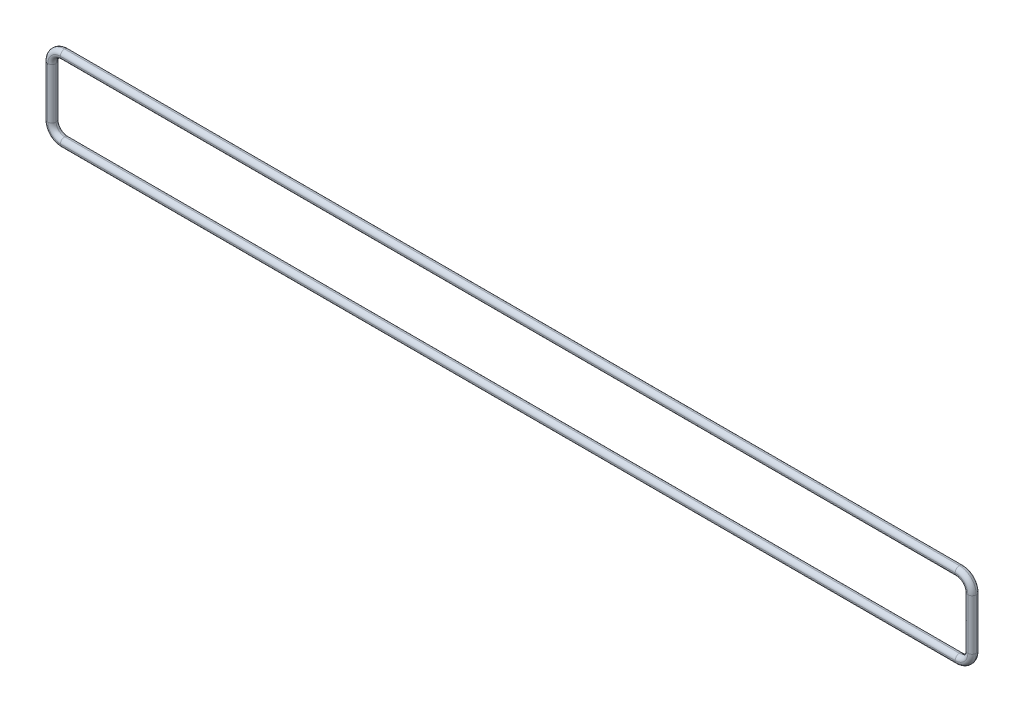
from build123d import *

# Parameters (mm, degrees)
BOSS_EXTRUDE1_DEPTH = 6.35
FILLET3_R           = 3.175


with BuildPart() as part:
    # Sketch2 → Boss-Extrude1 (new body)
    with BuildSketch(Plane.XY):
        with BuildLine():
            Line((0, 0), (0, 38.1))
            ThreePointArc((0, 38.1), (3.719743879, 47.080256121), (12.7, 50.8))
            Line((12.7, 50.8), (685.8, 50.8))
            ThreePointArc((685.8, 50.8), (694.780256121, 47.080256121), (698.5, 38.1))
            Line((698.5, 38.1), (698.5, 0))
            ThreePointArc((698.5, 0), (694.780256121, -8.980256121), (685.8, -12.7))
            Line((685.8, -12.7), (12.7, -12.7))
            ThreePointArc((12.7, -12.7), (3.719743879, -8.980256121), (0, 0))
        make_face()
        with BuildLine():
            Line((6.35, 38.1), (6.35, 0))
            ThreePointArc((6.35, 0), (8.209871939, -4.490128061), (12.7, -6.35))
            Line((12.7, -6.35), (685.8, -6.35))
            ThreePointArc((685.8, -6.35), (690.290128061, -4.490128061), (692.15, 0))
            Line((692.15, 0), (692.15, 38.1))
            ThreePointArc((692.15, 38.1), (690.290128061, 42.590128061), (685.8, 44.45))
            Line((685.8, 44.45), (12.7, 44.45))
            ThreePointArc((12.7, 44.45), (8.209871939, 42.590128061), (6.35, 38.1))
        make_face(mode=Mode.SUBTRACT)
    extrude(amount=BOSS_EXTRUDE1_DEPTH)

    # Fillet3
    fillet3_edges = [part.edges().sort_by_distance(p)[0] for p in [
        (0, 19.05, 6.35),
        (3.719743879, 47.080256121, 6.35),
        (349.25, 50.8, 6.35),
        (694.780256121, 47.080256121, 6.35),
        (698.5, 19.05, 6.35),
        (694.780256121, -8.980256121, 6.35),
        (349.25, -12.7, 6.35),
        (3.719743879, -8.980256121, 6.35),
        (0, 19.05, 0),
        (3.719743879, 47.080256121, 0),
        (349.25, 50.8, 0),
        (694.780256121, 47.080256121, 0),
        (698.5, 19.05, 0),
        (694.780256121, -8.980256121, 0),
        (349.25, -12.7, 0),
        (3.719743879, -8.980256121, 0),
        (349.25, 44.45, 6.35),
        (690.290128061, 42.590128061, 6.35),
        (692.15, 19.05, 6.35),
        (690.290128061, -4.490128061, 6.35),
        (349.25, -6.35, 6.35),
        (8.209871939, -4.490128061, 6.35),
        (6.35, 19.05, 6.35),
        (8.209871939, 42.590128061, 6.35),
        (349.25, 44.45, 0),
        (690.290128061, 42.590128061, 0),
        (692.15, 19.05, 0),
        (690.290128061, -4.490128061, 0),
        (349.25, -6.35, 0),
        (8.209871939, -4.490128061, 0),
        (6.35, 19.05, 0),
        (8.209871939, 42.590128061, 0),
    ]]
    fillet(fillet3_edges, radius=FILLET3_R - 0.0001)  # a hair under: the kernel refuses the full size


solid = part.part
